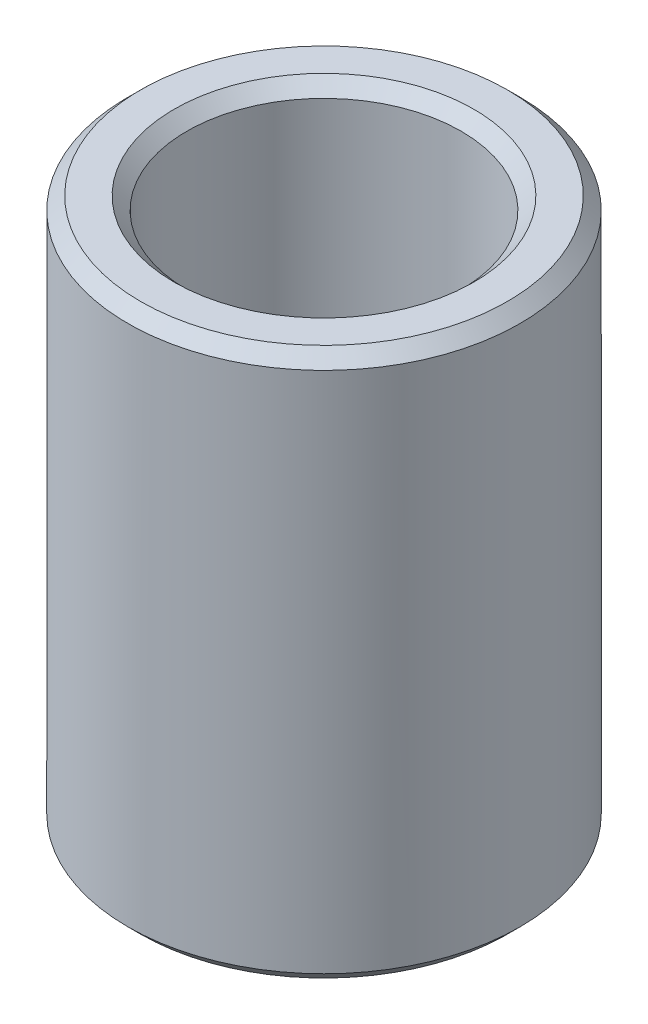
from build123d import *

# Parameters (mm, degrees)
SKETCH1_R           = 42.5
BOSS_EXTRUDE1_DEPTH = 118.777284969
SKETCH2_R           = 29.729422098
CUT_EXTRUDE1_DEPTH  = 134.118531485
CHAMFER1_SIZE       = 2.752923323


with BuildPart() as part:
    # Sketch1 → Boss-Extrude1 (new body)
    with BuildSketch(Plane(origin=(0, 0, 0), x_dir=(1, 0, 0), z_dir=(0, 1, 0))):
        Circle(SKETCH1_R)
    extrude(amount=BOSS_EXTRUDE1_DEPTH)

    # Sketch2 → Cut-Extrude1 (cut, through all)
    with BuildSketch(Plane(origin=(0, 0, 0), x_dir=(1, 0, 0), z_dir=(0, 1, 0))):
        Circle(SKETCH2_R)
    extrude(amount=CUT_EXTRUDE1_DEPTH, mode=Mode.SUBTRACT)

    # Chamfer1
    chamfer1_edges = [part.edges().sort_by_distance(p)[0] for p in [
        (-29.729422098, 118.777284969, 0),
        (-29.729422098, 0, 0),
        (-42.5, 0, 0),
        (-42.5, 118.777284969, 0),
    ]]
    chamfer(chamfer1_edges, length=CHAMFER1_SIZE)


solid = part.part
